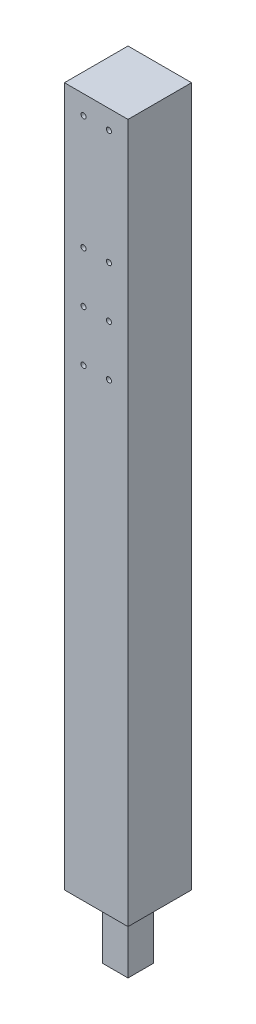
from build123d import *

# Parameters (mm, degrees)
SKETCH2_W               = 25
SKETCH2_H               = 25
BOSS_EXTRUDE1_DEPTH     = 300
SKETCH3_R               = 1
CUT_EXTRUDE1_DEPTH      = 303.07614934
CUT_EXTRUDE2_DEPTH      = 303.07614934
CUT_EXTRUDE2_DEPTH_BACK = 303.07614934
SKETCH4_W               = 7.5
SKETCH4_H               = 25
SKETCH5_W               = 7.5
SKETCH5_H               = 25
CUT_EXTRUDE3_DEPTH      = 302.548089034


with BuildPart() as part:
    # Sketch2 → Boss-Extrude1 (new body)
    with BuildSketch(Plane(origin=(0, 0, 0), x_dir=(1, 0, 0), z_dir=(0, 1, 0))):
        with Locations((12.5, 12.5)):
            Rectangle(SKETCH2_W, SKETCH2_H)
    extrude(amount=BOSS_EXTRUDE1_DEPTH)

    # Sketch3 → Cut-Extrude1 (cut, through all)
    with BuildSketch(Plane.XY):
        with Locations((7.5, 292.5)):
            Circle(SKETCH3_R)
        with Locations((7.5, 247.5)):
            Circle(SKETCH3_R)
        with Locations((7.5, 227.5)):
            Circle(SKETCH3_R)
        with Locations((7.5, 207.5)):
            Circle(SKETCH3_R)
        with Locations((17.5, 292.5)):
            Circle(SKETCH3_R)
        with Locations((17.5, 247.5)):
            Circle(SKETCH3_R)
        with Locations((17.5, 227.5)):
            Circle(SKETCH3_R)
        with Locations((17.5, 207.5)):
            Circle(SKETCH3_R)
    extrude(amount=-CUT_EXTRUDE1_DEPTH, mode=Mode.SUBTRACT)

    # Sketch4 → Cut-Extrude2 (cut, two sides: drawn at the far end of the back side and taken through both)
    with BuildSketch(Plane.ZY.offset(-CUT_EXTRUDE2_DEPTH_BACK)):
        with Locations((-21.25, 12.5)):
            Rectangle(SKETCH4_W, SKETCH4_H)
        with Locations((-3.75, 12.5)):
            Rectangle(SKETCH4_W, SKETCH4_H)
    extrude(amount=CUT_EXTRUDE2_DEPTH + CUT_EXTRUDE2_DEPTH_BACK, mode=Mode.SUBTRACT)

    # Sketch5 → Cut-Extrude3 (cut, through all)
    with BuildSketch(Plane(origin=(0, 0, -17.5), x_dir=(-1, 0, 0), z_dir=(0, 0, -1))):
        with Locations((-21.25, 12.5)):
            Rectangle(SKETCH5_W, SKETCH5_H)
        with Locations((-3.75, 12.5)):
            Rectangle(SKETCH5_W, SKETCH5_H)
    extrude(amount=-CUT_EXTRUDE3_DEPTH, mode=Mode.SUBTRACT)


solid = part.part
